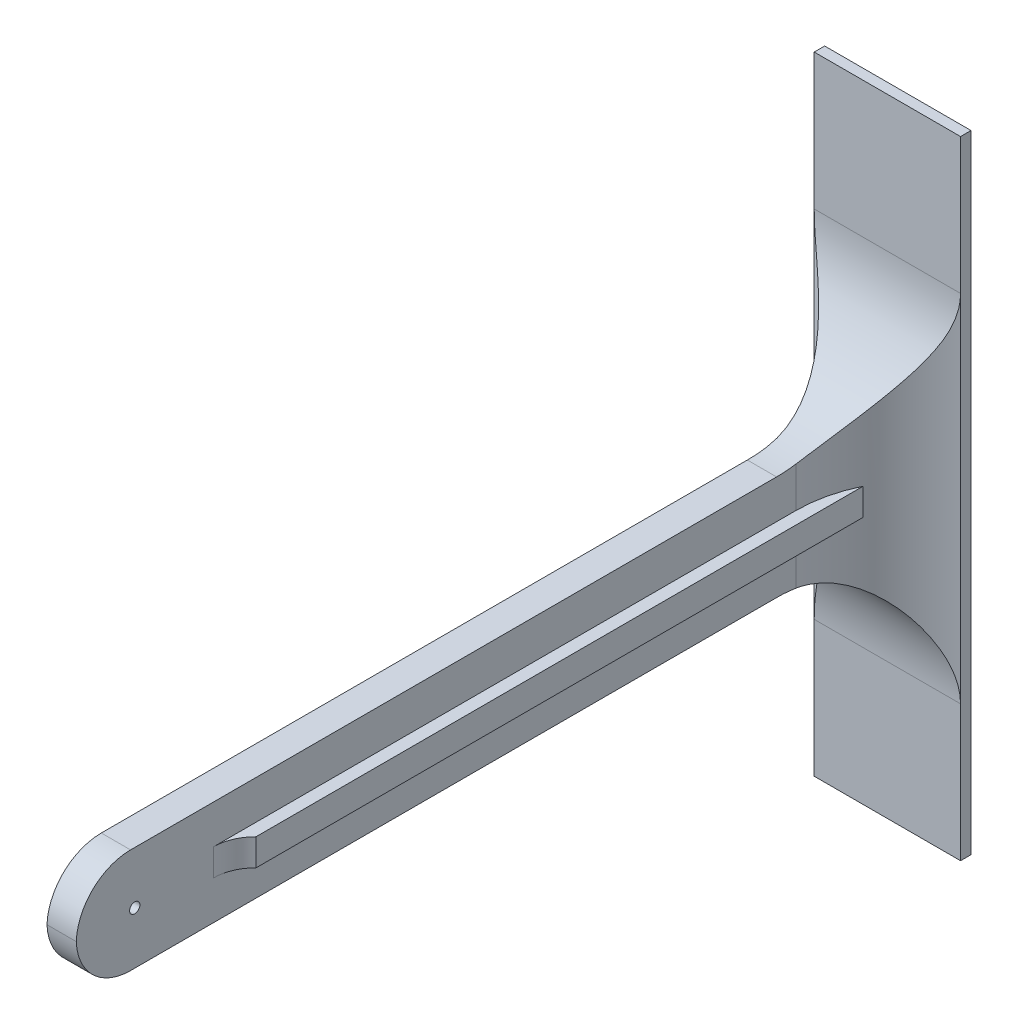
from build123d import *

# Parameters (mm, degrees)
ESQUISSE1_W             = 35
ESQUISSE1_H             = 150
BOSS_EXTRU_1_DEPTH      = 2.5
ESQUISSE1_5_W           = 35
ESQUISSE1_5_H           = 150
BOSS_EXTRU_2_DEPTH      = 2.5
ESQUISSE1_6_R           = 2
ENL_V_MAT_EXTRU_4_DEPTH = 2.5
ESQUISSE1_7_R           = 2
ENL_V_MAT_EXTRU_5_DEPTH = 2.5
ESQUISSE1_8_R           = 2
ENL_V_MAT_EXTRU_6_DEPTH = 2.5
ESQUISSE1_9_R           = 2
ENL_V_MAT_EXTRU_7_DEPTH = 2.5
CONG_2_R                = 3
ESQUISSE1_10_W          = 7
ESQUISSE1_10_H          = 25
BOSS_EXTRU_3_DEPTH      = 200
CONG_3_START            = -12.5
CONG_3_DEPTH            = 25
CONG_3_START_2          = -17.500000724
CONG_3_2_DEPTH          = 35.000000724
CONG_3_START_3          = -72
CONG_3_3_DEPTH          = 144
CONG_4_R                = 13
ESQUISSE11_R            = 1.2295
ENL_V_MAT_EXTRU_9_DEPTH = 10
ESQUISSE1_12_W          = 13
ESQUISSE1_12_H          = 6.447751058
BOSS_EXTRU_4_DEPTH      = 160
CONG_5_R                = 10
CONG_6_R                = 10


with BuildPart() as part:
    # Esquisse1 → Boss.-Extru.1 (new body)
    with BuildSketch(Plane.XY):
        Rectangle(ESQUISSE1_W, ESQUISSE1_H)
    extrude(amount=BOSS_EXTRU_1_DEPTH)


with BuildPart() as body_2:
    # Esquisse1<5> → Boss.-Extru.2 (new body)
    with BuildSketch(Plane.XY):
        Rectangle(ESQUISSE1_5_W, ESQUISSE1_5_H)
    extrude(amount=BOSS_EXTRU_2_DEPTH)

    # Esquisse1<6> → Enlèv. mat.-Extru.4 (cut)
    with BuildSketch(Plane.XY):
        with Locations((-13, 63.375)):
            Circle(ESQUISSE1_6_R)
    extrude(amount=ENL_V_MAT_EXTRU_4_DEPTH, mode=Mode.SUBTRACT)

    # Esquisse1<7> → Enlèv. mat.-Extru.5 (cut)
    with BuildSketch(Plane.XY):
        with Locations((13, 63.375)):
            Circle(ESQUISSE1_7_R)
    extrude(amount=ENL_V_MAT_EXTRU_5_DEPTH, mode=Mode.SUBTRACT)

    # Esquisse1<8> → Enlèv. mat.-Extru.6 (cut)
    with BuildSketch(Plane.XY):
        with Locations((-13, -63.375)):
            Circle(ESQUISSE1_8_R)
    extrude(amount=ENL_V_MAT_EXTRU_6_DEPTH, mode=Mode.SUBTRACT)

    # Esquisse1<9> → Enlèv. mat.-Extru.7 (cut)
    with BuildSketch(Plane.XY):
        with Locations((13, -63.375)):
            Circle(ESQUISSE1_9_R)
    extrude(amount=ENL_V_MAT_EXTRU_7_DEPTH, mode=Mode.SUBTRACT)

    # Congé2
    cong_2_edges = [body_2.edges().sort_by_distance(p)[0] for p in [
        (17.5, -75, 1.25),
        (17.5, 75, 1.25),
        (-17.5, 75, 1.25),
        (-17.5, -75, 1.25),
    ]]
    fillet(cong_2_edges, radius=CONG_2_R)

    # Esquisse1<10> → Boss.-Extru.3 (add)
    with BuildSketch(Plane.XY):
        Rectangle(ESQUISSE1_10_W, ESQUISSE1_10_H)
    extrude(amount=BOSS_EXTRU_3_DEPTH)

    # Congé3: read off the stored shape, not the designer's step
    # Congé3 outline → Congé3 (add)
    with BuildSketch(Plane(origin=(0, 0, 0), x_dir=(1, 0, 0), z_dir=(0, 1, 0)).offset(CONG_3_START)):
        with BuildLine():
            Line((17.500019353, -2.499987798), (3.5, -2.5))
            Line((3.5, -2.5), (3.5, -27.877155081))
            ThreePointArc((3.5, -27.877155081), (7.232154453, -13.385768319), (17.500019353, -2.499987798))
        make_face()
        with BuildLine():
            ThreePointArc((-17.500019353, -2.499987798), (-7.232154453, -13.385768319), (-3.5, -27.877155081))
            Line((-3.5, -27.877155081), (-3.5, -2.5))
            Line((-3.5, -2.5), (-17.500019353, -2.499987798))
        make_face()
    extrude(amount=CONG_3_DEPTH)

    # Cong_3 2 outline → Cong_3 2 (add)
    with BuildSketch(Plane.YZ.offset(CONG_3_START_2)):
        with BuildLine():
            Line((-42.5, 2.5), (-12.5, 2.5))
            Line((-12.5, 2.5), (-12.5, 32.5))
            ThreePointArc((-12.5, 32.5), (-21.286796564, 11.286796564), (-42.5, 2.5))
        make_face()
        with BuildLine():
            ThreePointArc((42.5, 2.5), (21.286796564, 11.286796564), (12.5, 32.5))
            Line((12.5, 32.5), (12.5, 2.5))
            Line((12.5, 2.5), (42.5, 2.5))
        make_face()
    extrude(amount=CONG_3_2_DEPTH)

    # Cong_3 3 outline → Cong_3 3 (cut)
    with BuildSketch(Plane(origin=(0, 0, 0), x_dir=(1, 0, 0), z_dir=(0, 1, 0)).offset(CONG_3_START_3)):
        with BuildLine():
            Line((-3.5, -34), (-3.5, -27.877155081))
            ThreePointArc((-3.5, -27.877155081), (-7.232154453, -13.385768319), (-17.500019353, -2.499987798))
            Line((-17.500019353, -2.499987798), (-19, -1.554269111))
            Line((-19, -1.554269111), (-19, -34))
            Line((-19, -34), (-3.5, -34))
        make_face()
        with BuildLine():
            Line((3.5, -27.877155081), (3.5, -34))
            Line((3.5, -34), (17.5, -34))
            Line((17.5, -34), (17.5, -32.5))
            Line((17.5, -32.5), (17.500019353, -2.499987798))
            ThreePointArc((17.500019353, -2.499987798), (7.232154453, -13.385768319), (3.5, -27.877155081))
        make_face()
    extrude(amount=CONG_3_3_DEPTH, mode=Mode.SUBTRACT)

    # Congé4
    # the kernel refuses this fillet: 13 mm, written as the material it takes off along each edge
    with BuildSketch(Plane(origin=(36, -12.5, 200), x_dir=(0, 0, -1), z_dir=(-1, 0, 0))) as cong_4_piece_1:
        with BuildLine():
            CenterArc((CONG_4_R, -CONG_4_R), CONG_4_R, 90, 90)
            Line((0, -CONG_4_R), (0, 0))
            Line((0, 0), (CONG_4_R, 0))
        make_face()
    extrude(amount=72, mode=Mode.SUBTRACT)
    with BuildSketch(Plane(origin=(-36, 12.5, 200), x_dir=(0, -1, 0), z_dir=(1, 0, 0))) as cong_4_piece_2:
        with BuildLine():
            CenterArc((CONG_4_R, CONG_4_R), CONG_4_R, 180, 90)
            Line((0, CONG_4_R), (0, 0))
            Line((0, 0), (CONG_4_R, 0))
        make_face()
    extrude(amount=72, mode=Mode.SUBTRACT)

    # Esquisse11 → Enlèv. mat.-Extru.9 (cut)
    with BuildSketch(Plane(origin=(3.5, 0, 0), x_dir=(0, 0, -1), z_dir=(1, 0, 0))):
        with Locations(Location((-186, 0, 0), (0, 0, 90))):
            Circle(ESQUISSE11_R)
    extrude(amount=-ENL_V_MAT_EXTRU_9_DEPTH, mode=Mode.SUBTRACT)

    # Esquisse1<12> → Boss.-Extru.4 (add)
    with BuildSketch(Plane.XY):
        Rectangle(ESQUISSE1_12_W, ESQUISSE1_12_H)
    extrude(amount=BOSS_EXTRU_4_DEPTH)

    # Congé5
    # the kernel refuses this fillet: 10 mm, written as the material it adds along each edge
    with BuildSketch(Plane(origin=(3.5, -3.223875529, 160), x_dir=(0, 0, 1), z_dir=(0, 1, 0))) as cong_5_piece_1:
        with BuildLine():
            CenterArc((7.141428429, 10), CONG_5_R, 224.427004001, 45.572995999)
            Line((0, 3), (-0.142828569, 2.86))
            ThreePointArc((-0.142828569, 2.86), (-0.2, 1.5), (-0.2, 0))
            Line((-0.2, 0), (0, -0.2))
            Line((0, -0.2), (7.141428429, -0.2))
            Line((7.141428429, -0.2), (7.141428429, 0))
        make_face()
    extrude(amount=6.447751059)

    # Congé6
    # the kernel refuses this fillet: 10 mm, written as the material it adds along each edge
    with BuildSketch(Plane(origin=(-3.5, 3.223875529, 160), x_dir=(-1, 0, 0), z_dir=(0, -1, 0))) as cong_6_piece_1:
        with BuildLine():
            CenterArc((10, -7.141428429), CONG_6_R, 134.427004001, 45.572995999)
            Line((0, -7.141428429), (-0.2, -7.141428429))
            Line((-0.2, -7.141428429), (-0.2, 0))
            Line((-0.2, 0), (0, 0.2))
            ThreePointArc((0, 0.2), (1.5, 0.2), (2.86, 0.142828569))
            Line((2.86, 0.142828569), (3, 0))
        make_face()
    extrude(amount=6.447751059)


solid = Compound([part.part, body_2.part])
